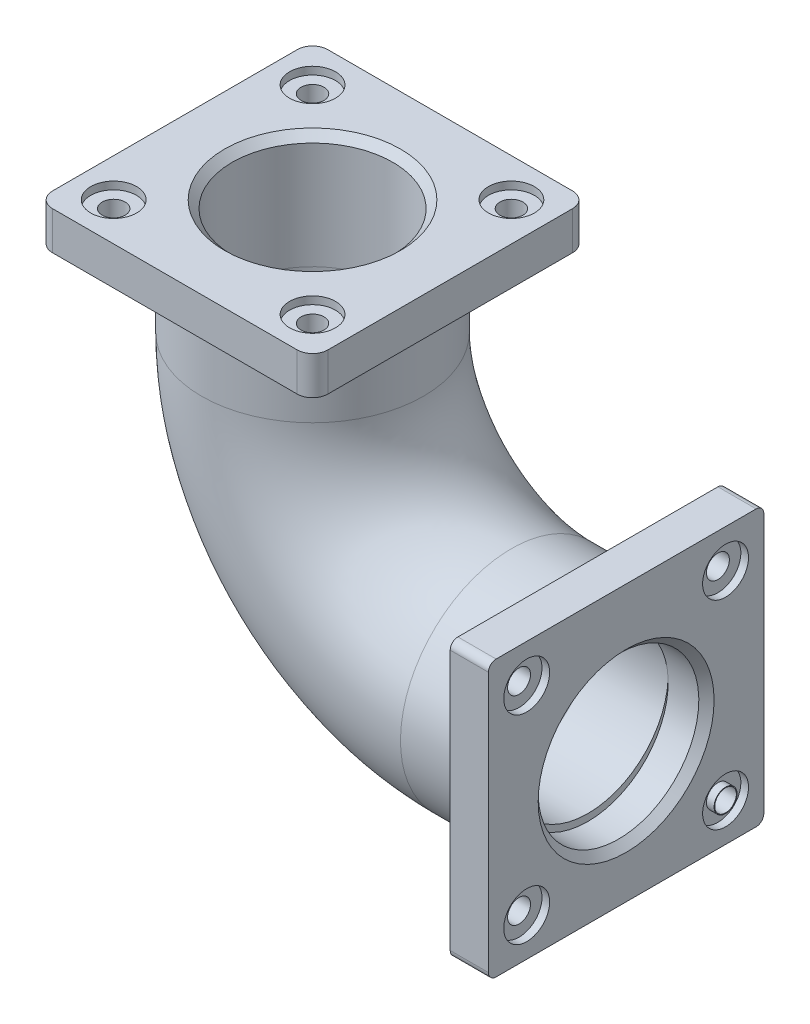
from build123d import *

# Parameters (mm, degrees)
SKETCH2_R           = 30
SKETCH2_R_2         = 105
SKETCH2_R_3         = 28.090856429
SKETCH2_R_4         = 15
BOSS_EXTRUDE2_DEPTH = 50
SKETCH5_R           = 30
CUT_EXTRUDE1_DEPTH  = 10
CHAMFER2_SIZE       = 10
BOSS_EXTRUDE3_START = 100
SKETCH6_R           = 145
SKETCH6_R_2         = 105
BOSS_EXTRUDE3_DEPTH = 100
CUT_EXTRUDE2_START  = -10
SKETCH9_R           = 30
SKETCH9_R_2         = 15
CUT_EXTRUDE2_DEPTH  = 10
SWEEP3_OUTLINE_R    = 145
SWEEP3_OUTLINE_R_2  = 105
SWEEP3_ANGLE        = 90
SKETCH12_R          = 145
SKETCH12_R_2        = 105
BOSS_EXTRUDE5_DEPTH = 100
BOSS_EXTRUDE6_DEPTH = 50
SKETCH14_R          = 105
CUT_EXTRUDE5_DEPTH  = 50
SKETCH17_R          = 30
SKETCH17_R_2        = 15
CUT_EXTRUDE6_DEPTH  = 10
SKETCH18_R          = 15
SKETCH18_R_2        = 14.143688161
CUT_EXTRUDE7_DEPTH  = 100
CHAMFER3_SIZE       = 10


# Read off the part's stored shape, not the designer's step: Sweep3
with BuildPart() as part:
    # Sketch2 → Boss-Extrude2 (new body)
    # profile 1 of 5: a face of its own
    with BuildSketch(Plane(origin=(0, 0, 0), x_dir=(1, 0, 0), z_dir=(0, 1, 0))):
        with BuildLine():
            Line((-180, -130), (-180, -160))
            ThreePointArc((-180, -160), (-174.142135624, -174.142135624), (-160, -180))
            Line((-160, -180), (160, -180))
            ThreePointArc((160, -180), (174.142135624, -174.142135624), (180, -160))
            Line((180, -160), (180, 160))
            ThreePointArc((180, 160), (174.142135624, 174.142135624), (160, 180))
            Line((160, 180), (-160, 180))
            ThreePointArc((-160, 180), (-174.142135624, 174.142135624), (-180, 160))
            Line((-180, 160), (-180, -130))
        make_face()
        with Locations((-130, -130)):
            Circle(SKETCH2_R, mode=Mode.SUBTRACT)
        with Locations((130, -130)):
            Circle(SKETCH2_R, mode=Mode.SUBTRACT)
        with Locations((-130, 130)):
            Circle(SKETCH2_R, mode=Mode.SUBTRACT)
        with Locations(Location((0, 0, 0), (0, 0, 270))):
            Circle(SKETCH2_R_2, mode=Mode.SUBTRACT)
        with Locations((130, 130)):
            Circle(SKETCH2_R_3, mode=Mode.SUBTRACT)
    # profile 2 of 5: a face of its own
    with BuildSketch(Plane(origin=(0, 0, 0), x_dir=(1, 0, 0), z_dir=(0, 1, 0))):
        with Locations((-130, 130)):
            Circle(SKETCH2_R)
        with Locations(Location((-130, 130, 0), (0, 0, 270))):
            Circle(SKETCH2_R_4, mode=Mode.SUBTRACT)
    # profile 3 of 5: a face of its own
    with BuildSketch(Plane(origin=(0, 0, 0), x_dir=(1, 0, 0), z_dir=(0, 1, 0))):
        with Locations((130, 130)):
            Circle(SKETCH2_R_3)
        with Locations(Location((130, 130, 0), (0, 0, 270))):
            Circle(SKETCH2_R_4, mode=Mode.SUBTRACT)
    # profile 4 of 5: a face of its own
    with BuildSketch(Plane(origin=(0, 0, 0), x_dir=(1, 0, 0), z_dir=(0, 1, 0))):
        with Locations((-130, -130)):
            Circle(SKETCH2_R)
        with Locations(Location((-130, -130, 0), (0, 0, 270))):
            Circle(SKETCH2_R_4, mode=Mode.SUBTRACT)
    # profile 5 of 5: a face of its own
    with BuildSketch(Plane(origin=(0, 0, 0), x_dir=(1, 0, 0), z_dir=(0, 1, 0))):
        with Locations((130, -130)):
            Circle(SKETCH2_R)
        with Locations(Location((130, -130, 0), (0, 0, 270))):
            Circle(SKETCH2_R_4, mode=Mode.SUBTRACT)
    extrude(amount=BOSS_EXTRUDE2_DEPTH)

    # Sketch5 → Cut-Extrude1 (cut)
    with BuildSketch(Plane(origin=(0, 50, 0), x_dir=(1, 0, 0), z_dir=(0, 1, 0))):
        with Locations(Location((-130, 130, 0), (0, 0, 270))):
            Circle(SKETCH5_R)
        with Locations(Location((130, 130, 0), (0, 0, 270))):
            Circle(SKETCH5_R)
        with Locations(Location((-130, -130, 0), (0, 0, 270))):
            Circle(SKETCH5_R)
    extrude(amount=-CUT_EXTRUDE1_DEPTH, mode=Mode.SUBTRACT)

    # Chamfer2
    chamfer2_edges = [part.edges().sort_by_distance(p)[0] for p in [
        (0, 50, -105),
    ]]
    chamfer(chamfer2_edges, length=CHAMFER2_SIZE)

    # Sketch6 → Boss-Extrude3 (add)
    with BuildSketch(Plane.XZ.offset(BOSS_EXTRUDE3_START)):
        with Locations(Location((0, 0, 0), (0, 0, 90))):
            Circle(SKETCH6_R)
        with Locations(Location((0, 0, 0), (0, 0, 270))):
            Circle(SKETCH6_R_2, mode=Mode.SUBTRACT)
    extrude(amount=-BOSS_EXTRUDE3_DEPTH)

    # Sketch9 → Cut-Extrude2 (cut)
    with BuildSketch(Plane(origin=(0, 50, 0), x_dir=(1, 0, 0), z_dir=(0, 1, 0)).offset(CUT_EXTRUDE2_START)):
        with Locations(Location((130, -130, 0), (0, 0, 270))):
            Circle(SKETCH9_R)
        with Locations(Location((130, -130, 0), (0, 0, 270))):
            Circle(SKETCH9_R_2, mode=Mode.SUBTRACT)
    extrude(amount=CUT_EXTRUDE2_DEPTH, mode=Mode.SUBTRACT)

    # Sweep3 outline → Sweep3 (revolve)
    with BuildSketch(Plane(origin=(260, -100, 0), x_dir=(-1, 0, 0), z_dir=(0, 1, 0))):
        with Locations((260, 0)):
            Circle(SWEEP3_OUTLINE_R)
        with Locations((260, 0)):
            Circle(SWEEP3_OUTLINE_R_2, mode=Mode.SUBTRACT)
    revolve(axis=Axis((260, -100, 0), (0, 0, 1)), revolution_arc=SWEEP3_ANGLE)

    # Sketch12 → Boss-Extrude5 (add)
    with BuildSketch(Plane(origin=(260, 0, 0), x_dir=(0, 0, -1), z_dir=(1, 0, 0))):
        with Locations(Location((0, -360, 0), (0, 0, 270))):
            Circle(SKETCH12_R)
        with Locations(Location((0, -360, 0), (0, 0, 270))):
            Circle(SKETCH12_R_2, mode=Mode.SUBTRACT)
    extrude(amount=BOSS_EXTRUDE5_DEPTH)

    # Sketch13 → Boss-Extrude6 (add)
    with BuildSketch(Plane(origin=(360, 0, 0), x_dir=(0, 0, -1), z_dir=(1, 0, 0))):
        with BuildLine():
            Line((-170, -540), (170, -540))
            ThreePointArc((170, -540), (177.071067812, -537.071067812), (180, -530))
            Line((180, -530), (180, -190))
            ThreePointArc((180, -190), (177.071067812, -182.928932188), (170, -180))
            Line((170, -180), (-170, -180))
            ThreePointArc((-170, -180), (-177.071067812, -182.928932188), (-180, -190))
            Line((-180, -190), (-180, -530))
            ThreePointArc((-180, -530), (-177.071067812, -537.071067812), (-170, -540))
        make_face()
    extrude(amount=BOSS_EXTRUDE6_DEPTH)

    # Sketch14 → Cut-Extrude5 (cut)
    with BuildSketch(Plane(origin=(410, 0, 0), x_dir=(0, 0, -1), z_dir=(1, 0, 0))):
        with Locations(Location((0, -369.029004143, 0), (0, 0, 90))):
            Circle(SKETCH14_R)
    extrude(amount=-CUT_EXTRUDE5_DEPTH, mode=Mode.SUBTRACT)

    # Sketch17 → Cut-Extrude6 (cut)
    # profile 1 of 4: a face of its own
    with BuildSketch(Plane(origin=(410, 0, 0), x_dir=(0, 0, -1), z_dir=(1, 0, 0))):
        with Locations(Location((-130, -230, 0), (0, 0, 90))):
            Circle(SKETCH17_R)
        with Locations(Location((-130, -230, 0), (0, 0, 90))):
            Circle(SKETCH17_R_2, mode=Mode.SUBTRACT)
    # profile 2 of 4: a face of its own
    with BuildSketch(Plane(origin=(410, 0, 0), x_dir=(0, 0, -1), z_dir=(1, 0, 0))):
        with Locations(Location((-130, -490, 0), (0, 0, 90))):
            Circle(SKETCH17_R)
        with Locations(Location((-130, -490, 0), (0, 0, 90))):
            Circle(SKETCH17_R_2, mode=Mode.SUBTRACT)
    # profile 3 of 4: a face of its own
    with BuildSketch(Plane(origin=(410, 0, 0), x_dir=(0, 0, -1), z_dir=(1, 0, 0))):
        with Locations(Location((130, -490, 0), (0, 0, 90))):
            Circle(SKETCH17_R)
        with Locations(Location((130, -490, 0), (0, 0, 90))):
            Circle(SKETCH17_R_2, mode=Mode.SUBTRACT)
    # profile 4 of 4: a face of its own
    with BuildSketch(Plane(origin=(410, 0, 0), x_dir=(0, 0, -1), z_dir=(1, 0, 0))):
        with Locations(Location((130, -230, 0), (0, 0, 90))):
            Circle(SKETCH17_R)
        with Locations(Location((130, -230, 0), (0, 0, 90))):
            Circle(SKETCH17_R_2, mode=Mode.SUBTRACT)
    extrude(amount=-CUT_EXTRUDE6_DEPTH, mode=Mode.SUBTRACT)

    # Sketch18 → Cut-Extrude7 (cut)
    with BuildSketch(Plane(origin=(410, 0, 0), x_dir=(0, 0, -1), z_dir=(1, 0, 0))):
        with Locations(Location((-130, -230, 0), (0, 0, 90))):
            Circle(SKETCH18_R)
        with Locations(Location((130, -230, 0), (0, 0, 90))):
            Circle(SKETCH18_R)
        with Locations(Location((-130, -490, 0), (0, 0, 90))):
            Circle(SKETCH18_R)
        with Locations(Location((130, -490, 0), (0, 0, 90))):
            Circle(SKETCH18_R_2)
    extrude(amount=-CUT_EXTRUDE7_DEPTH, mode=Mode.SUBTRACT)

    # Chamfer3
    chamfer3_edges = [part.edges().sort_by_distance(p)[0] for p in [
        (410, -474.029004143, 0),
    ]]
    chamfer(chamfer3_edges, length=CHAMFER3_SIZE)


solid = part.part
